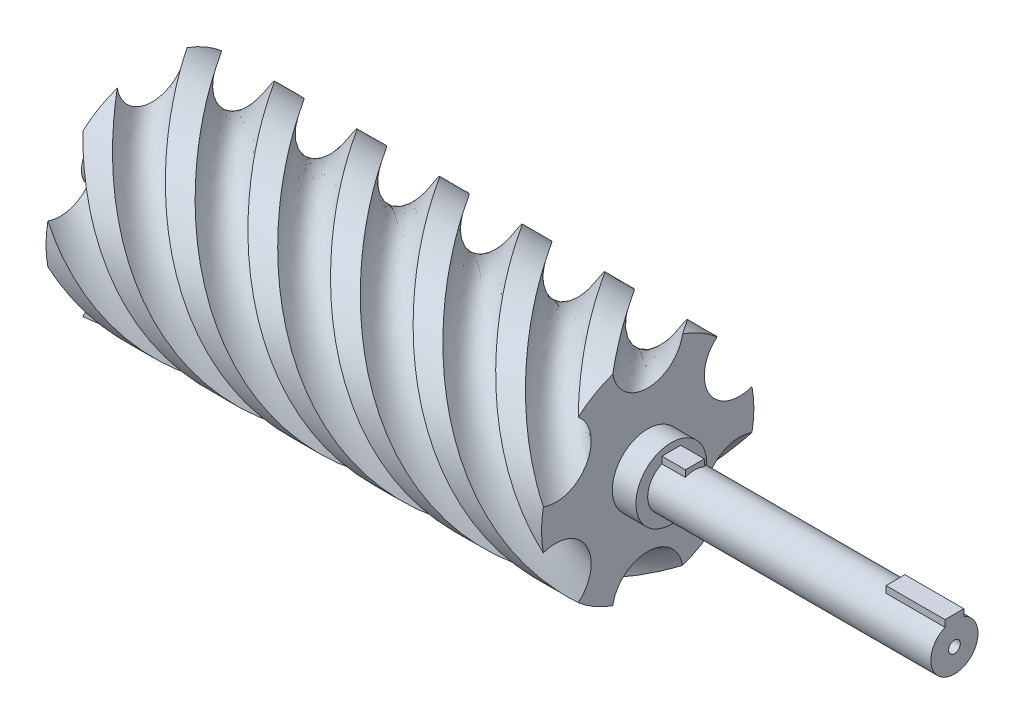
from build123d import *

# Parameters (mm, degrees)
SWEEP1_PITCH                = 210
SWEEP1_HEIGHT               = 210
SWEEP1_RADIUS               = 60
SWEEP1_START_ANGLE          = -90
BOSS_EXTRUDE1_DEPTH         = 340
BOSS_EXTRUDE1_DEPTH_BACK    = 20
SKETCH3_R                   = 10
SKETCH4_R                   = 15
BOSS_EXTRUDE2_DEPTH         = 10
SKETCH5_W                   = 8
SKETCH5_H                   = 7
BOSS_EXTRUDE3_DEPTH         = 10
SKETCH6_W                   = 8
SKETCH6_H                   = 6.283716925
BOSS_EXTRUDE4_DEPTH         = 25
TAP_DRILL_FOR_M6_TAP1_D     = 5
TAP_DRILL_FOR_M6_TAP1_DEPTH = 20
TAP_DRILL_FOR_M6_TAP1_TIP   = 1.502151548


with BuildPart() as part:
    # Sweep1: sweep along a helix
    with BuildLine() as sweep1_path:
        add(Helix(SWEEP1_PITCH, SWEEP1_HEIGHT, SWEEP1_RADIUS, center=(0, 0, 0), direction=(1, 0, 0), mode=Mode.PRIVATE).rotate(Axis((0, 0, 0), (1, 0, 0)), SWEEP1_START_ANGLE))
    # Sketch1 → Sweep1 (sweep)
    with BuildSketch(Plane(origin=(0, 0, 0), x_dir=(0, 0, -1), z_dir=(1, 0, 0))):
        with BuildLine():
            ThreePointArc((-29.410979932, -34.058688457), (-22.5, -38.97114317), (-14.790199458, -42.5))
            ThreePointArc((-14.790199458, -42.5), (0, -30), (14.790199458, -42.5))
            ThreePointArc((14.790199458, -42.5), (22.5, -38.97114317), (29.410979932, -34.058688457))
            ThreePointArc((29.410979932, -34.058688457), (25.980762114, -15), (44.20117939, -8.441311543))
            ThreePointArc((44.20117939, -8.441311543), (45, 0), (44.20117939, 8.441311543))
            ThreePointArc((44.20117939, 8.441311543), (25.980762114, 15), (29.410979932, 34.058688457))
            ThreePointArc((29.410979932, 34.058688457), (22.5, 38.97114317), (14.790199458, 42.5))
            ThreePointArc((14.790199458, 42.5), (0, 30), (-14.790199458, 42.5))
            ThreePointArc((-14.790199458, 42.5), (-22.5, 38.97114317), (-29.410979932, 34.058688457))
            ThreePointArc((-29.410979932, 34.058688457), (-25.980762114, 15), (-44.20117939, 8.441311543))
            ThreePointArc((-44.20117939, 8.441311543), (-45, 0), (-44.20117939, -8.441311543))
            ThreePointArc((-44.20117939, -8.441311543), (-25.980762114, -15), (-29.410979932, -34.058688457))
        make_face()
    sweep(path=sweep1_path.line, is_frenet=True)

    # Sketch3 → Boss-Extrude1 (add, two sides: drawn at the far end of the back side and taken through both)
    with BuildSketch(Plane(origin=(0, 0, 0), x_dir=(0, 0, -1), z_dir=(1, 0, 0)).offset(-BOSS_EXTRUDE1_DEPTH_BACK)):
        Circle(SKETCH3_R)
    extrude(amount=BOSS_EXTRUDE1_DEPTH + BOSS_EXTRUDE1_DEPTH_BACK)

    # Sketch4 → Boss-Extrude2 (add)
    with BuildSketch(Plane(origin=(210, 0, 0), x_dir=(0, 0, -1), z_dir=(1, 0, 0))):
        Circle(SKETCH4_R)
    extrude(amount=BOSS_EXTRUDE2_DEPTH)

    # Sketch5 → Boss-Extrude3 (add)
    with BuildSketch(Plane(origin=(220, 0, 0), x_dir=(0, 0, -1), z_dir=(1, 0, 0))):
        with Locations((0, 8.5)):
            Rectangle(SKETCH5_W, SKETCH5_H)
    extrude(amount=BOSS_EXTRUDE3_DEPTH)

    # Sketch6 → Boss-Extrude4 (add)
    with BuildSketch(Plane(origin=(340, 0, 0), x_dir=(0, 0, -1), z_dir=(1, 0, 0))):
        with Locations((0, 8.858141537)):
            Rectangle(SKETCH6_W, SKETCH6_H)
    extrude(amount=-BOSS_EXTRUDE4_DEPTH)

    # Tap Drill for M6 Tap1
    with Locations(Plane(origin=(340, 0, 0), x_dir=(0, 0, -1), z_dir=(1, 0, 0))):
        with Locations((0, 0)):
            Hole(TAP_DRILL_FOR_M6_TAP1_D / 2, depth=TAP_DRILL_FOR_M6_TAP1_DEPTH)
            with Locations((0, 0, -(TAP_DRILL_FOR_M6_TAP1_DEPTH + TAP_DRILL_FOR_M6_TAP1_TIP / 2))):  # 118° drill point
                Cone(0, TAP_DRILL_FOR_M6_TAP1_D / 2, TAP_DRILL_FOR_M6_TAP1_TIP, mode=Mode.SUBTRACT)


solid = part.part
